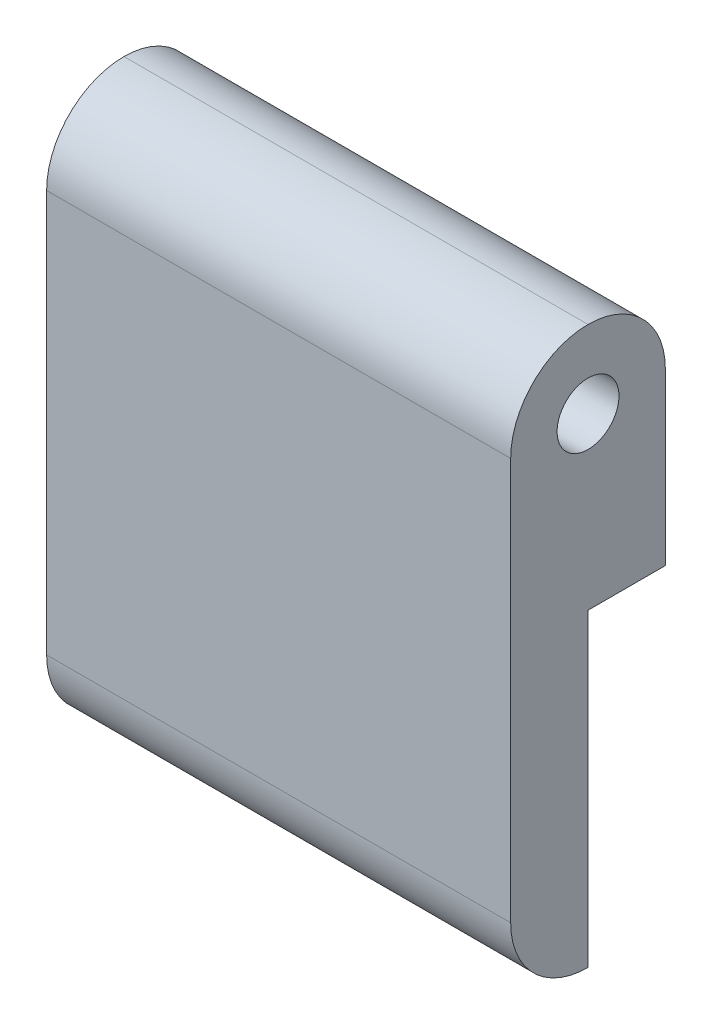
from build123d import *

# Parameters (mm, degrees)
SKETCH1_W           = 15
SKETCH1_H           = 8
BOSS_EXTRUDE1_DEPTH = 5
SKETCH2_W           = 15
SKETCH2_H           = 2.5
BOSS_EXTRUDE2_DEPTH = 10
SKETCH4_R           = 1
CUT_EXTRUDE1_DEPTH  = 22.118712082
FILLET1_R           = 2.5


with BuildPart() as part:
    # Sketch1 → Boss-Extrude1 (new body)
    with BuildSketch(Plane.XY):
        Rectangle(SKETCH1_W, SKETCH1_H)
    extrude(amount=BOSS_EXTRUDE1_DEPTH)

    # Sketch2 → Boss-Extrude2 (add)
    with BuildSketch(Plane.XZ.offset(4)):
        with Locations((0, 3.75)):
            Rectangle(SKETCH2_W, SKETCH2_H)
    extrude(amount=BOSS_EXTRUDE2_DEPTH)

    # Sketch4 → Cut-Extrude1 (cut, through all)
    with BuildSketch(Plane(origin=(7.5, 0, 0), x_dir=(0, 0, -1), z_dir=(1, 0, 0))):
        with Locations((-2.5, 1.5)):
            Circle(SKETCH4_R)
    extrude(amount=-CUT_EXTRUDE1_DEPTH, mode=Mode.SUBTRACT)

    # Fillet1
    fillet1_edges = [part.edges().sort_by_distance(p)[0] for p in [
        (0, -14, 5),
        (0, 4, 0),
        (0, 4, 5),
    ]]
    fillet(fillet1_edges, radius=FILLET1_R - 0.0001)  # a hair under: the kernel refuses the full size


solid = part.part
